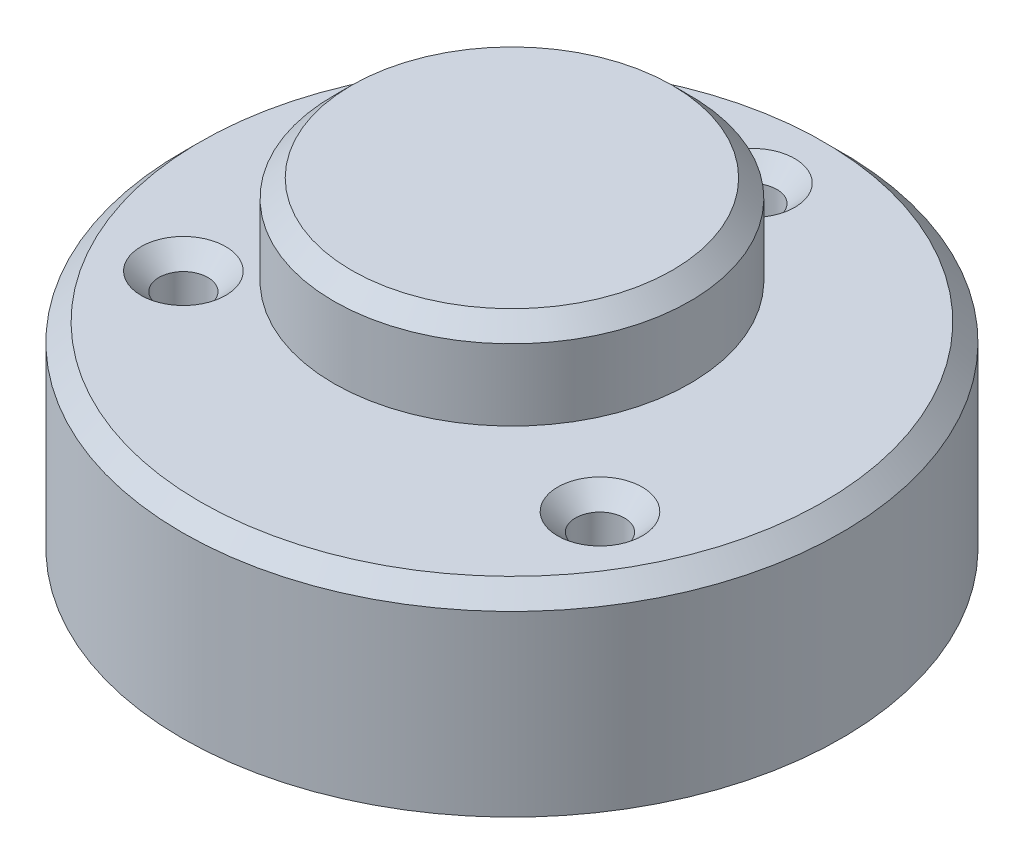
from build123d import *

# Parameters (mm, degrees)
SKETCH2_R           = 18.5
SKETCH2_R_2         = 1.375
BOSS_EXTRUDE1_DEPTH = 11
SKETCH4_R           = 5
BOSS_EXTRUDE3_DEPTH = 2
SKETCH5_R           = 10
BOSS_EXTRUDE4_DEPTH = 5
FILLET1_R           = 1
CHAMFER3_SIZE       = 1
CHAMFER4_SIZE       = 1


with BuildPart() as part:
    # Sketch2 → Boss-Extrude1 (new body)
    with BuildSketch(Plane(origin=(0, 0, 0), x_dir=(1, 0, 0), z_dir=(0, 1, 0))):
        with Locations(Location((0, 0, 0), (0, 0, 270))):
            Circle(SKETCH2_R)
        with Locations(Location((0, 13.5, 0), (0, 0, 270))):
            Circle(SKETCH2_R_2, mode=Mode.SUBTRACT)
        with Locations(Location((-11.691342951, -6.75, 0), (0, 0, 270))):
            Circle(SKETCH2_R_2, mode=Mode.SUBTRACT)
        with Locations(Location((11.691342951, -6.75, 0), (0, 0, 270))):
            Circle(SKETCH2_R_2, mode=Mode.SUBTRACT)
    extrude(amount=BOSS_EXTRUDE1_DEPTH)

    # Sketch4 → Boss-Extrude3 (add)
    with BuildSketch(Plane(origin=(0, 11, 0), x_dir=(1, 0, 0), z_dir=(0, 1, 0))):
        with Locations(Location((0, 0, 0), (0, 0, 270))):
            Circle(SKETCH4_R)
    extrude(amount=BOSS_EXTRUDE3_DEPTH)

    # Sketch5 → Boss-Extrude4 (add)
    with BuildSketch(Plane(origin=(0, 13, 0), x_dir=(1, 0, 0), z_dir=(0, 1, 0))):
        with Locations(Location((0, 0, 0), (0, 0, 270))):
            Circle(SKETCH5_R)
    extrude(amount=BOSS_EXTRUDE4_DEPTH)

    # Fillet1
    fillet1_edges = [part.edges().sort_by_distance(p)[0] for p in [
        (0, 11, -5),
        (0, 13, -5),
    ]]
    fillet(fillet1_edges, radius=FILLET1_R - 0.0001)  # a hair under: the kernel refuses the full size

    # Chamfer3
    chamfer3_edges = [part.edges().sort_by_distance(p)[0] for p in [
        (11.691342951, 11, 5.375),
        (0, 11, -14.875),
        (-11.691342951, 11, 5.375),
    ]]
    chamfer(chamfer3_edges, length=CHAMFER3_SIZE)

    # Chamfer4
    chamfer4_edges = [part.edges().sort_by_distance(p)[0] for p in [
        (0, 18, -10),
        (0, 11, -18.5),
    ]]
    chamfer(chamfer4_edges, length=CHAMFER4_SIZE)


solid = part.part
